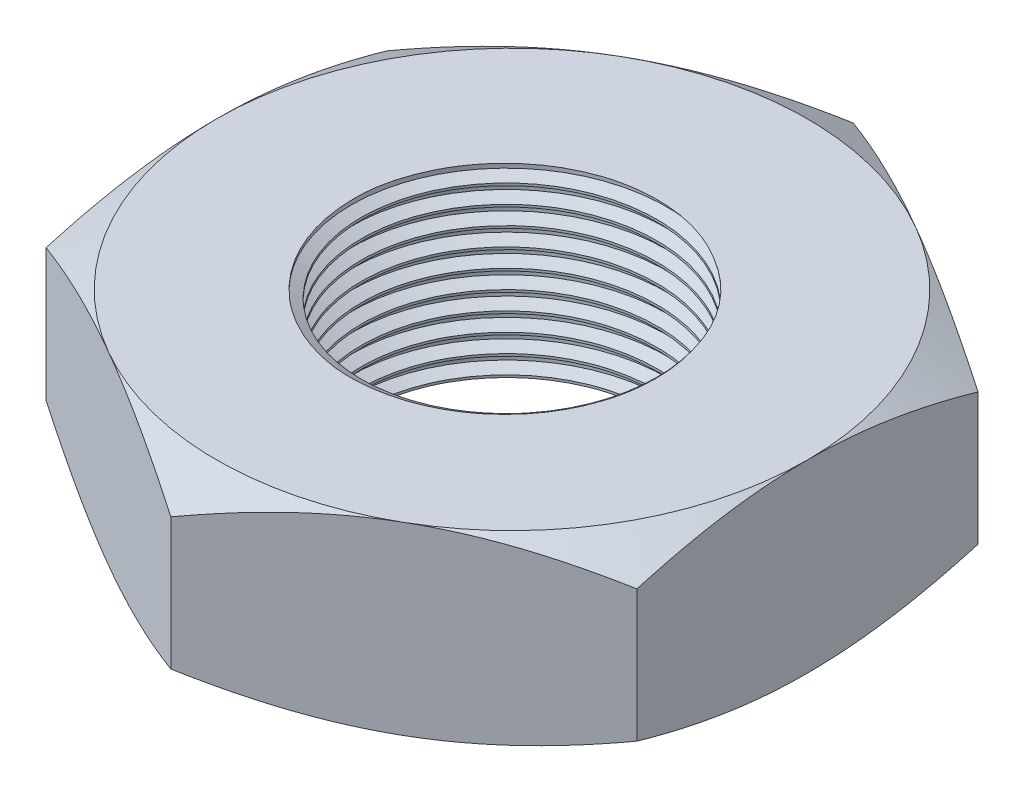
from build123d import *

# Parameters (mm, degrees)
SKETCH1_R                    = 12
BOSS_EXTRUDE1_DEPTH          = 7.5
SKETCH2_OUTSIDE_W            = 205.648
SKETCH2_OUTSIDE_H            = 213.074
SKETCH2_OUTSIDE_R            = 24
CUT_EXTRUDE1_DEPTH           = 40.610604641
CUT_EXTRUDE1_TAPER           = 60
CUT_EXTRUDE1_OTHER_WAY_DEPTH = 40.610604641
THREAD1_PITCH                = 1.5


with BuildPart() as part:
    # Sketch1 → Boss-Extrude1 (new, symmetric)
    with BuildSketch(Plane(origin=(0, 0, 0), x_dir=(1, 0, 0), z_dir=(0, 1, 0))):
        Polygon((0, 27.712812921), (-24, 13.856406461), (-24, -13.856406461), (0, -27.712812921), (24, -13.856406461), (24, 13.856406461), align=None)
        with Locations(Location((0, 0, 0), (0, 0, 270))):
            Circle(SKETCH1_R, mode=Mode.SUBTRACT)
    extrude(amount=BOSS_EXTRUDE1_DEPTH, both=True)

    # Sketch2 outside → Cut-Extrude1 (cut)
    with BuildSketch(Plane(origin=(0, 7.5, 0), x_dir=(1, 0, 0), z_dir=(0, 1, 0))):
        Rectangle(SKETCH2_OUTSIDE_W, SKETCH2_OUTSIDE_H)
        Circle(SKETCH2_OUTSIDE_R, mode=Mode.SUBTRACT)
    cut_extrude1 = extrude(amount=-CUT_EXTRUDE1_DEPTH, taper=CUT_EXTRUDE1_TAPER, mode=Mode.SUBTRACT)

    # Sketch2 outside → Cut-Extrude1 other way (cut)
    with BuildSketch(Plane(origin=(0, 7.5, 0), x_dir=(1, 0, 0), z_dir=(0, 1, 0))):
        Rectangle(SKETCH2_OUTSIDE_W, SKETCH2_OUTSIDE_H)
        Circle(SKETCH2_OUTSIDE_R, mode=Mode.SUBTRACT)
    extrude(amount=CUT_EXTRUDE1_OTHER_WAY_DEPTH, mode=Mode.SUBTRACT)

    # Mirror1: Cut-Extrude1 across plane
    add(cut_extrude1.mirror(Plane.ZX), mode=Mode.SUBTRACT)

    # Thread1: the profile of Thread Profile1 profile screwed along a right-hand helix of 18 turns, 8 arcs to a turn; built about Z, then put on its axis
    thread1_z = Axis((0, 0, 0), (0, 0, 1))
    thread1_corners = [(11.9997, 0, -0.000173205), (11.9997, 0, 1.312673201), (12.811898813, 0, 0.843749998), (12.811898813, 0, 0.468749998)]
    with BuildLine(mode=Mode.PRIVATE) as thread1_profile:
        Line(thread1_corners[0], thread1_corners[1])
        Line(thread1_corners[1], thread1_corners[2])
        Line(thread1_corners[2], thread1_corners[3])
        Line(thread1_corners[3], thread1_corners[0])
    thread1_cap = Face(thread1_profile.wire())
    thread1_turn_angles = [0, 22.5, 45, 67.5, 90, 112.5, 135, 157.5, 180, 202.5, 225, 247.5, 270, 292.5, 315, 337.5, 360]
    thread1_turn_weights = [1, 0.9238795325112867, 1, 0.9238795325112867, 1, 0.9238795325112867, 1, 0.9238795325112867, 1, 0.9238795325112867, 1, 0.9238795325112867, 1, 0.9238795325112867, 1, 0.9238795325112867, 1]
    thread1_turn_rails = [Edge.make_bspline([Vector(p[0], p[1], 0).rotate(thread1_z, thread1_turn_angles[k]) / thread1_turn_weights[k] + Vector(0, 0, p[2] + THREAD1_PITCH * thread1_turn_angles[k] / 360) for k in range(17)], [0, 0, 0, 1, 1, 2, 2, 3, 3, 4, 4, 5, 5, 6, 6, 7, 7, 8, 8, 8], 2, thread1_turn_weights) for p in thread1_corners]
    thread1_turn_sides = [Face.make_surface_from_curves(thread1_turn_rails[p[0]], thread1_turn_rails[p[1]]) for p in [(0, 1), (1, 2), (2, 3), (3, 0)]]
    thread1 = Plane(origin=(0, 12.5, 0), x_dir=(-1, 0, 0), z_dir=(0, -1, 0)) * Solid(Shell([*[p.moved(Location((0, 0, THREAD1_PITCH * i))) for i in range(18) for p in thread1_turn_sides], thread1_cap, thread1_cap.rotate(thread1_z, 6480).moved(Location((0, 0, THREAD1_PITCH * 6480 / 360)))]))
    add(thread1, mode=Mode.SUBTRACT)


solid = part.part
